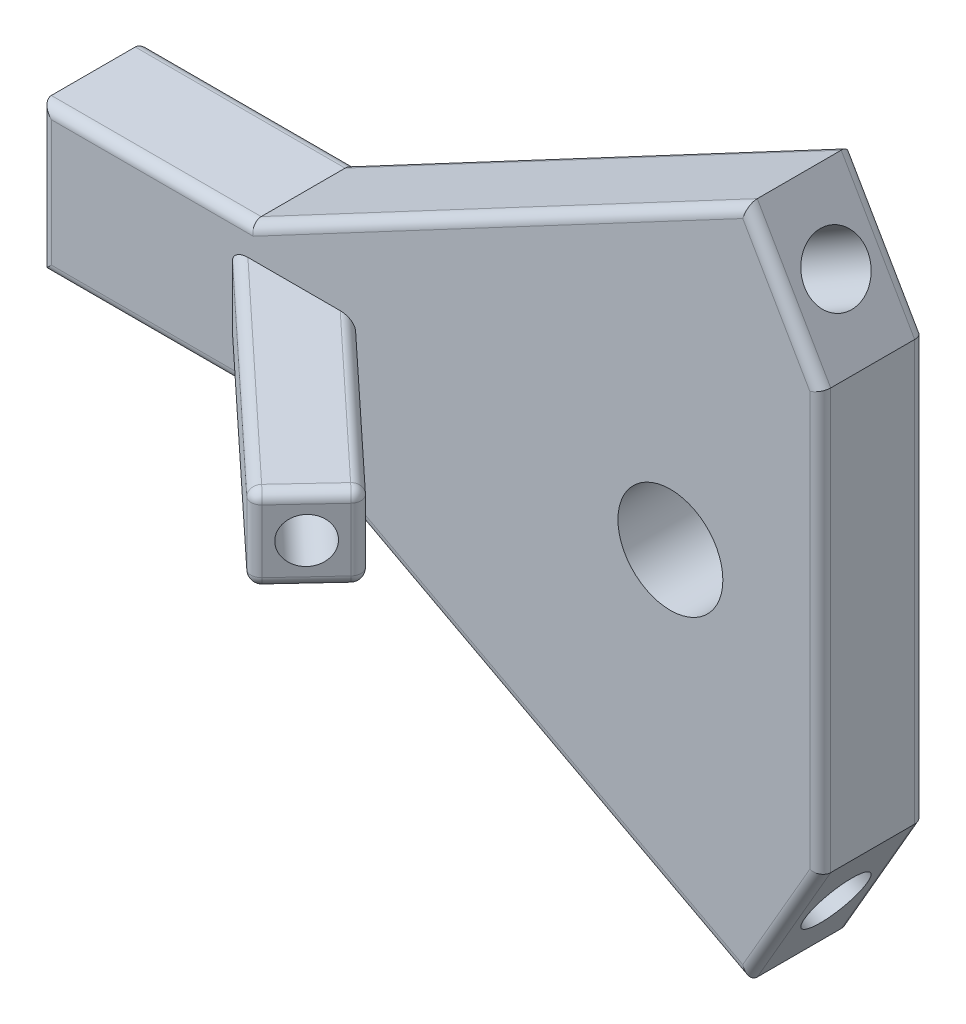
from build123d import *

# Parameters (mm, degrees)
BOSS_EXTRU_2_DEPTH       = 10
ESQUISSE6_R              = 3
ENL_V_MAT_EXTRU_4_DEPTH  = 20
ESQUISSE7_R              = 3
ENL_V_MAT_EXTRU_5_DEPTH  = 20
ESQUISSE8_R              = 5
ENL_V_MAT_EXTRU_6_DEPTH  = 20
BOSS_EXTRU_3_DEPTH       = 10.94
ENL_V_MAT_EXTRU_9_DEPTH  = 10
ESQUISSE14_W             = 21.055359181
ESQUISSE14_H             = 15.627906255
ENL_V_MAT_EXTRU_10_DEPTH = 10
ESQUISSE15_R             = 2.15
ENL_V_MAT_EXTRU_11_DEPTH = 20
ESQUISSE19_W             = 45
ESQUISSE19_H             = 8
BOSS_EXTRU_6_DEPTH       = 8
ENL_V_MAT_EXTRU_13_DEPTH = 8
ESQUISSE21_R             = 2.15
ENL_V_MAT_EXTRU_14_DEPTH = 20
ESQUISSE4_R              = 3
ENL_V_MAT_EXTRU_3_DEPTH  = 20
CONG_1_R                 = 1
CONG_2_R                 = 1


with BuildPart() as part:
    # Esquisse1 → Boss.-Extru.2 (new body)
    with BuildSketch(Plane.XY):
        Polygon((-20, -7), (-20, 7), (0, 7), (47.282032303, 32.124355653), (54.282032303, 20), (54.282032303, -20), (47.282032303, -32.124355653), (0, -7), align=None)
    extrude(amount=BOSS_EXTRU_2_DEPTH)

    # Esquisse6 → Enlèv. mat.-Extru.4 (cut)
    with BuildSketch(Plane(origin=(49.371778265, 28.504809472, 0), x_dir=(0.4999999999999953, -0.8660254037844415, 0), z_dir=(0.8660254037844415, 0.4999999999999953, 0))):
        with Locations(Location((2.820508076, -5, 0), (0, 0, 180))):
            Circle(ESQUISSE6_R)
    extrude(amount=-ENL_V_MAT_EXTRU_4_DEPTH, mode=Mode.SUBTRACT)

    # Esquisse7 → Enlèv. mat.-Extru.5 (cut)
    with BuildSketch(Plane(origin=(49.371778265, -28.504809472, 0), x_dir=(-0.5000000000000256, -0.8660254037844237, 0), z_dir=(0.8660254037844238, -0.5000000000000258, 0))):
        with Locations(Location((-2.820508076, -5, 0), (0, 0, 180))):
            Circle(ESQUISSE7_R)
    extrude(amount=-ENL_V_MAT_EXTRU_5_DEPTH, mode=Mode.SUBTRACT)

    # Esquisse8 → Enlèv. mat.-Extru.6 (cut)
    with BuildSketch(Plane(origin=(0, 0, 0), x_dir=(-1, 0, 0), z_dir=(0, 0, -1))):
        with Locations((-40, 0)):
            Circle(ESQUISSE8_R)
    extrude(amount=-ENL_V_MAT_EXTRU_6_DEPTH, mode=Mode.SUBTRACT)

    # Esquisse3D2 → Boss.-Extru.3 (add, along a direction that is not the sketch's normal)
    with BuildSketch(Plane(origin=(-11.940611049, 4, -10.459950802), x_dir=(0.7221683612814543, -0.15799050110667315, 0.6734328916262713), z_dir=(-0.6819983600624996, 0, 0.7313537016191696))):
        Polygon((0, 0), (49.372031596, 7.899525055), (50.635955605, 0), (1.263924009, -7.899525055), align=None)
    extrude(amount=BOSS_EXTRU_3_DEPTH, dir=(0, 0, 1))

    # Esquisse11 → Enlèv. mat.-Extru.9 (cut)
    with BuildSketch(Plane(origin=(0, -4, 0), x_dir=(-1, 0, 0), z_dir=(0, -1, 0))):
        Polygon((-19.170398677, -29.491535113), (-24.627074032, -23.639967201), (-24.627074032, -34.579967201), (-21.088649198, -31.280332662), align=None)
    extrude(amount=-ENL_V_MAT_EXTRU_9_DEPTH, mode=Mode.SUBTRACT)

    # Esquisse14 → Enlèv. mat.-Extru.10 (cut)
    with BuildSketch(Plane(origin=(0, -4, 0), x_dir=(-1, 0, 0), z_dir=(0, -1, 0))):
        with Locations((1.412931459, 7.813953128)):
            Rectangle(ESQUISSE14_W, ESQUISSE14_H)
    extrude(amount=-ENL_V_MAT_EXTRU_10_DEPTH, mode=Mode.SUBTRACT)

    # Esquisse15 → Enlèv. mat.-Extru.11 (cut)
    with BuildSketch(Plane(origin=(24.963676652, 0, 23.279005084), x_dir=(0.6819983600624997, 0, -0.7313537016191695), z_dir=(0.7313537016191695, 0, 0.6819983600624997))):
        with Locations((-4.494058163, 0)):
            Circle(ESQUISSE15_R)
    extrude(amount=-ENL_V_MAT_EXTRU_11_DEPTH, mode=Mode.SUBTRACT)

    # Esquisse19 → Boss.-Extru.6 (add)
    with BuildSketch(Plane(origin=(4.442655339, 0, 4.968839596), x_dir=(-0.7454759996828609, 0, 0.6665324702494538), z_dir=(-0.6665324702494538, 0, -0.7454759996828609))):
        with Locations((-4.954759997, 0)):
            Rectangle(ESQUISSE19_W, ESQUISSE19_H)
    extrude(amount=BOSS_EXTRU_6_DEPTH)

    # Esquisse20 → Enlèv. mat.-Extru.13 (cut)
    with BuildSketch(Plane(origin=(0, -4, 0), x_dir=(-1, 0, 0), z_dir=(0, -1, 0))):
        Polygon((8.636899992, -16.663311756), (13.969159754, -10.699503759), (13.186807375, -10), (1.71363405, -10), (1.463807332, -10.249826718), align=None)
    extrude(amount=-ENL_V_MAT_EXTRU_13_DEPTH, mode=Mode.SUBTRACT)

    # Esquisse21 → Enlèv. mat.-Extru.14 (cut)
    with BuildSketch(Plane(origin=(20.466864655, 0, -18.299489001), x_dir=(-0.6665324702494541, 0, -0.7454759996828608), z_dir=(0.7454759996828608, 0, -0.6665324702494541))):
        with Locations((-2.665324702, 0)):
            Circle(ESQUISSE21_R)
    extrude(amount=-ENL_V_MAT_EXTRU_14_DEPTH, mode=Mode.SUBTRACT)

    # Esquisse4 → Enlèv. mat.-Extru.3 (cut)
    with BuildSketch(Plane.ZY.offset(20)):
        with Locations((5, 0)):
            Circle(ESQUISSE4_R)
    extrude(amount=-ENL_V_MAT_EXTRU_3_DEPTH, mode=Mode.SUBTRACT)

    # Congé1
    # the kernel refuses this fillet: 1 mm, written as the material it takes off along each edge
    with BuildSketch(Plane(origin=(23.497511524, 3, -13.409592934), x_dir=(0, 1, 0), z_dir=(0.666532470249454, 0, 0.745475999682861))) as cong_1_piece_1_section:
        Polygon((0, 0), (CONG_1_R, 0), (CONG_1_R, -CONG_1_R), (0, -CONG_1_R), align=None)
    cong_1_piece_1 = extrude(amount=CONG_1_R, mode=Mode.PRIVATE)
    cong_1_piece_1 = cong_1_piece_1 - Plane(origin=(23.497511524, 3, -13.409592934), x_dir=(-0.5271311345875715, -0.7071067811865474, 0.4713096295944097), z_dir=(0.666532470249454, 0, 0.745475999682861)) * Sphere(CONG_1_R, mode=Mode.PRIVATE)
    add(cong_1_piece_1, mode=Mode.SUBTRACT)
    with BuildSketch(Plane(origin=(23.497511524, -3, -13.409592934), x_dir=(0, -1, 0), z_dir=(0.666532470249454, 0, 0.745475999682861))) as cong_1_piece_2_section:
        Polygon((0, 0), (CONG_1_R, 0), (CONG_1_R, CONG_1_R), (0, CONG_1_R), align=None)
    cong_1_piece_2 = extrude(amount=CONG_1_R, mode=Mode.PRIVATE)
    cong_1_piece_2 = cong_1_piece_2 - Plane(origin=(23.497511524, -3, -13.409592934), x_dir=(-0.5271311345875714, 0.7071067811865476, 0.4713096295944094), z_dir=(0.666532470249454, 0, 0.745475999682861)) * Sphere(CONG_1_R, mode=Mode.PRIVATE)
    add(cong_1_piece_2, mode=Mode.SUBTRACT)
    with BuildSketch(Plane(origin=(19.498316702, 3, -17.882448933), x_dir=(-0.666532470249454, 0, -0.745475999682861), z_dir=(0.7454759996828609, 0, -0.6665324702494538))) as cong_1_piece_3_section:
        Polygon((0, 0), (CONG_1_R, 0), (CONG_1_R, CONG_1_R), (0, CONG_1_R), align=None)
    cong_1_piece_3 = extrude(amount=CONG_1_R, mode=Mode.PRIVATE)
    cong_1_piece_3 = cong_1_piece_3 - Plane(origin=(19.498316702, 3, -17.882448933), x_dir=(0.47130962959440953, -0.7071067811865474, 0.5271311345875718), z_dir=(0.7454759996828609, 0, -0.6665324702494538)) * Sphere(CONG_1_R, mode=Mode.PRIVATE)
    add(cong_1_piece_3, mode=Mode.SUBTRACT)
    with BuildSketch(Plane(origin=(19.498316702, -3, -17.882448933), x_dir=(-0.666532470249454, 0, -0.745475999682861), z_dir=(0, -1, 0))) as cong_1_piece_4_section:
        Polygon((0, 0), (CONG_1_R, 0), (CONG_1_R, CONG_1_R), (0, CONG_1_R), align=None)
    cong_1_piece_4 = extrude(amount=CONG_1_R, mode=Mode.PRIVATE)
    cong_1_piece_4 = cong_1_piece_4 - Plane(origin=(19.498316702, -3, -17.882448933), x_dir=(-0.05582150499316189, 0, 0.9984407641819811), z_dir=(0, -1, 0)) * Sphere(CONG_1_R, mode=Mode.PRIVATE)
    add(cong_1_piece_4, mode=Mode.SUBTRACT)
    with BuildSketch(Plane(origin=(19.121043336, -3, 28.078183051), x_dir=(-0.6819983600624996, 0, 0.7313537016191696), z_dir=(0.7313537016191692, 0, 0.6819983600624999))) as cong_1_piece_5_section:
        Polygon((0, 0), (CONG_1_R, 0), (CONG_1_R, CONG_1_R), (0, CONG_1_R), align=None)
    cong_1_piece_5 = extrude(amount=CONG_1_R, mode=Mode.PRIVATE)
    cong_1_piece_5 = cong_1_piece_5 - Plane(origin=(19.121043336, -3, 28.078183051), x_dir=(0.482245665158298, 0.7071067811865476, -0.5171451618607975), z_dir=(0.7313537016191692, 0, 0.6819983600624999)) * Sphere(CONG_1_R, mode=Mode.PRIVATE)
    add(cong_1_piece_5, mode=Mode.SUBTRACT)
    with BuildSketch(Plane(origin=(19.121043336, 3, 28.078183051), x_dir=(-0.6819983600624996, 0, 0.7313537016191696), z_dir=(0.7313537016191692, 0, 0.6819983600624999))) as cong_1_piece_6_section:
        Polygon((0, 0), (CONG_1_R, 0), (CONG_1_R, -CONG_1_R), (0, -CONG_1_R), align=None)
    cong_1_piece_6 = extrude(amount=CONG_1_R, mode=Mode.PRIVATE)
    cong_1_piece_6 = cong_1_piece_6 - Plane(origin=(19.121043336, 3, 28.078183051), x_dir=(0.4822456651582982, -0.7071067811865472, -0.5171451618607977), z_dir=(0.7313537016191692, 0, 0.6819983600624999)) * Sphere(CONG_1_R, mode=Mode.PRIVATE)
    add(cong_1_piece_6, mode=Mode.SUBTRACT)
    with BuildSketch(Plane(origin=(23.213721971, -3, 23.689322543), x_dir=(0.6819983600624996, 0, -0.7313537016191696), z_dir=(0.7313537016191692, 0, 0.6819983600624999))) as cong_1_piece_7_section:
        Polygon((0, 0), (CONG_1_R, 0), (CONG_1_R, -CONG_1_R), (0, -CONG_1_R), align=None)
    cong_1_piece_7 = extrude(amount=CONG_1_R, mode=Mode.PRIVATE)
    cong_1_piece_7 = cong_1_piece_7 - Plane(origin=(23.213721971, -3, 23.689322543), x_dir=(-0.4822456651582982, 0.7071067811865472, 0.5171451618607977), z_dir=(0.7313537016191692, 0, 0.6819983600624999)) * Sphere(CONG_1_R, mode=Mode.PRIVATE)
    add(cong_1_piece_7, mode=Mode.SUBTRACT)
    with BuildSketch(Plane(origin=(23.213721971, 3, 23.689322543), x_dir=(0.7313537016191692, 0, 0.6819983600624999), z_dir=(0.6819983600624996, 0, -0.7313537016191696))) as cong_1_piece_8_section:
        Polygon((0, 0), (CONG_1_R, 0), (CONG_1_R, -CONG_1_R), (0, -CONG_1_R), align=None)
    cong_1_piece_8 = extrude(amount=CONG_1_R, mode=Mode.PRIVATE)
    cong_1_piece_8 = cong_1_piece_8 - Plane(origin=(23.213721971, 3, 23.689322543), x_dir=(-0.5171451618607974, -0.7071067811865475, -0.48224566515829836), z_dir=(0.6819983600624996, 0, -0.7313537016191696)) * Sphere(CONG_1_R, mode=Mode.PRIVATE)
    add(cong_1_piece_8, mode=Mode.SUBTRACT)
    with BuildSketch(Plane(origin=(24.909519994, 3, -13.330649405), x_dir=(-0.7454759996828614, 0, 0.6665324702494536), z_dir=(0, -1, 0)), Plane(origin=(24.242987523, -4, -14.076125405), x_dir=(-0.7454759996828609, 0, 0.666532470249454), z_dir=(-0.666532470249454, 0, -0.745475999682861)), Plane(origin=(19.170398677, -3, 29.491535113), x_dir=(0.6819983600624999, 0, -0.7313537016191692), z_dir=(0, 1, 0))) as cong_1_piece_9:
        with BuildLine():
            CenterArc((CONG_1_R, CONG_1_R), CONG_1_R, 180, 90)
            Line((0, CONG_1_R), (0, 0))
            Line((0, 0), (CONG_1_R, 0))
        make_face()
    extrude(amount=6, mode=Mode.SUBTRACT)
    with BuildSketch(Plane(origin=(24.242987523, 4, -14.076125405), x_dir=(-0.745475999682861, 0, 0.6665324702494538), z_dir=(-0.666532470249454, 0, -0.745475999682861)), Plane(origin=(19.577260232, 3, -19.294457402), x_dir=(-0.7454759996828622, 0, 0.6665324702494525), z_dir=(0, -1, 0)), Plane(origin=(24.627074032, 3, 23.639967201), x_dir=(-0.7313537016191676, 0, -0.6819983600625017), z_dir=(0, -1, 0))) as cong_1_piece_10:
        with BuildLine():
            CenterArc((CONG_1_R, -CONG_1_R), CONG_1_R, 90, 90)
            Line((0, -CONG_1_R), (0, 0))
            Line((0, 0), (CONG_1_R, 0))
        make_face()
    extrude(amount=6, mode=Mode.SUBTRACT)
    with BuildSketch(Plane(origin=(19.852397038, -4, 28.760181411), x_dir=(-0.7313537016191692, 0, -0.6819983600624998), z_dir=(0.6819983600624999, 0, -0.7313537016191692)), Plane(origin=(23.945075672, 4, 24.371320903), x_dir=(-0.7313537016191692, 0, -0.6819983600624999), z_dir=(-0.6819983600624999, 0, 0.7313537016191692))) as cong_1_piece_11:
        with BuildLine():
            CenterArc((CONG_1_R, CONG_1_R), CONG_1_R, 180, 90)
            Line((0, CONG_1_R), (0, 0))
            Line((0, 0), (CONG_1_R, 0))
        make_face()
    extrude(amount=6.001009496, mode=Mode.SUBTRACT)
    with BuildSketch(Plane(origin=(23.895720331, -4, 22.957968841), x_dir=(0, 1, 0), z_dir=(-0.7313537016191696, 0, -0.6819983600624996))) as cong_1_piece_12_section:
        with BuildLine():
            CenterArc((CONG_1_R, -CONG_1_R), CONG_1_R, 90, 90)
            Line((0, -CONG_1_R), (0, 0))
            Line((0, 0), (CONG_1_R, 0))
        make_face()
    cong_1_piece_12 = extrude(amount=21.5, mode=Mode.PRIVATE)
    cong_1_piece_12 = split(cong_1_piece_12, bisect_by=Plane(origin=(16.701898304, -3.775135003, 10), z_dir=(0, 0, 1)), keep=Keep.TOP, mode=Mode.PRIVATE)
    add(cong_1_piece_12, mode=Mode.SUBTRACT)
    with BuildSketch(Plane(origin=(18.439044976, -4, 28.809536753), x_dir=(0.6819983600624996, -1.776356839400248e-15, -0.7313537016191696), z_dir=(-0.7313537016191696, 0, -0.6819983600624996))) as cong_1_piece_13_section:
        with BuildLine():
            CenterArc((CONG_1_R, -CONG_1_R), CONG_1_R, 90, 90)
            Line((0, -CONG_1_R), (0, 0))
            Line((0, 0), (CONG_1_R, 0))
        make_face()
    cong_1_piece_13 = extrude(amount=29.713716515, mode=Mode.PRIVATE)
    cong_1_piece_13 = split(cong_1_piece_13, bisect_by=Plane(origin=(8.594887091, -3.772527831, 10), z_dir=(0, 0, 1)), keep=Keep.TOP, mode=Mode.PRIVATE)
    add(cong_1_piece_13, mode=Mode.SUBTRACT)
    with BuildSketch(Plane(origin=(-3.292191586, 4, 8.544830818), x_dir=(0.6819983600624996, 0, -0.7313537016191696), z_dir=(0.7313537016191696, 0, 0.6819983600624996))) as cong_1_piece_14_section:
        with BuildLine():
            CenterArc((CONG_1_R, -CONG_1_R), CONG_1_R, 90, 90)
            Line((0, -CONG_1_R), (0, 0))
            Line((0, 0), (CONG_1_R, 0))
        make_face()
    cong_1_piece_14 = extrude(amount=29.713716515, mode=Mode.PRIVATE)
    cong_1_piece_14 = split(cong_1_piece_14, bisect_by=Plane(origin=(8.594887091, 3.772527831, 10), z_dir=(0, 0, 1)), keep=Keep.TOP, mode=Mode.PRIVATE)
    add(cong_1_piece_14, mode=Mode.SUBTRACT)
    with BuildSketch(Plane(origin=(8.171615746, 4, 8.2950041), x_dir=(0, -1, 0), z_dir=(0.7313537016191696, 0, 0.6819983600624996))) as cong_1_piece_15_section:
        with BuildLine():
            CenterArc((CONG_1_R, -CONG_1_R), CONG_1_R, 90, 90)
            Line((0, -CONG_1_R), (0, 0))
            Line((0, 0), (CONG_1_R, 0))
        make_face()
    cong_1_piece_15 = extrude(amount=21.5, mode=Mode.PRIVATE)
    cong_1_piece_15 = split(cong_1_piece_15, bisect_by=Plane(origin=(16.701898304, 3.775135003, 10), z_dir=(0, 0, 1)), keep=Keep.TOP, mode=Mode.PRIVATE)
    add(cong_1_piece_15, mode=Mode.SUBTRACT)
    with BuildSketch(Plane(origin=(24.164043994, -4, -12.664116935), x_dir=(0, 1, 0), z_dir=(-0.7454759996828609, 0, 0.6665324702494538))) as cong_1_piece_16_section:
        with BuildLine():
            CenterArc((CONG_1_R, CONG_1_R), CONG_1_R, 180, 90)
            Line((0, CONG_1_R), (0, 0))
            Line((0, 0), (CONG_1_R, 0))
        make_face()
    cong_1_piece_16 = extrude(amount=21.5, mode=Mode.PRIVATE)
    cong_1_piece_16 = split(cong_1_piece_16, bisect_by=Plane(origin=(16.833816535, -3.775199875, 0), z_dir=(0, 0, -1)), keep=Keep.TOP, mode=Mode.PRIVATE)
    add(cong_1_piece_16, mode=Mode.SUBTRACT)
    with BuildSketch(Plane(origin=(8.136310001, 4, 1.666331176), x_dir=(0, -1, 0), z_dir=(0.7454759996828609, 0, -0.6665324702494538))) as cong_1_piece_17_section:
        with BuildLine():
            CenterArc((CONG_1_R, CONG_1_R), CONG_1_R, 180, 90)
            Line((0, CONG_1_R), (0, 0))
            Line((0, 0), (CONG_1_R, 0))
        make_face()
    cong_1_piece_17 = extrude(amount=21.5, mode=Mode.PRIVATE)
    cong_1_piece_17 = split(cong_1_piece_17, bisect_by=Plane(origin=(16.833816535, 3.775199875, 0), z_dir=(0, 0, -1)), keep=Keep.TOP, mode=Mode.PRIVATE)
    add(cong_1_piece_17, mode=Mode.SUBTRACT)
    with BuildSketch(Plane(origin=(-3.866106021, 4, 1.666331176), x_dir=(0, -1, 0), z_dir=(0.7454759996828609, 0, -0.6665324702494538))) as cong_1_piece_18_section:
        with BuildLine():
            CenterArc((CONG_1_R, -CONG_1_R), CONG_1_R, 90, 90)
            Line((0, -CONG_1_R), (0, 0))
            Line((0, 0), (CONG_1_R, 0))
        make_face()
    cong_1_piece_18 = extrude(amount=30.447513082, mode=Mode.PRIVATE)
    cong_1_piece_18 = split(cong_1_piece_18, bisect_by=Plane(origin=(8.657930936, 3.772496042, 0), z_dir=(0, 0, -1)), keep=Keep.TOP, mode=Mode.PRIVATE)
    add(cong_1_piece_18, mode=Mode.SUBTRACT)
    with BuildSketch(Plane(origin=(18.831784232, -4, -18.627924932), x_dir=(0.6665324702494538, 0, 0.745475999682861), z_dir=(-0.7454759996828609, 0, 0.6665324702494538))) as cong_1_piece_19_section:
        with BuildLine():
            CenterArc((CONG_1_R, CONG_1_R), CONG_1_R, 180, 90)
            Line((0, CONG_1_R), (0, 0))
            Line((0, 0), (CONG_1_R, 0))
        make_face()
    cong_1_piece_19 = extrude(amount=30.447513082, mode=Mode.PRIVATE)
    cong_1_piece_19 = split(cong_1_piece_19, bisect_by=Plane(origin=(8.657930936, -3.772496042, 0), z_dir=(0, 0, -1)), keep=Keep.TOP, mode=Mode.PRIVATE)
    add(cong_1_piece_19, mode=Mode.SUBTRACT)

    # Congé2
    cong_2_edges = [part.edges().sort_by_distance(p)[0] for p in [
        (-10, 7, 10),
        (23.641016151, 19.562177826, 0),
        (50.782032303, 26.062177826, 0),
        (-20, 0, 10),
        (-10, -7, 10),
        (23.641016151, -19.562177826, 10),
        (50.782032303, -26.062177826, 10),
        (54.282032303, 0, 10),
        (50.782032303, 26.062177826, 10),
        (23.641016151, 19.562177826, 10),
        (54.282032303, 0, 0),
        (50.782032303, -26.062177826, 0),
        (23.641016151, -19.562177826, 0),
        (-10, -7, 0),
        (-20, 0, 0),
        (-10, 7, 0),
    ]]
    fillet(cong_2_edges, radius=CONG_2_R)


solid = part.part
